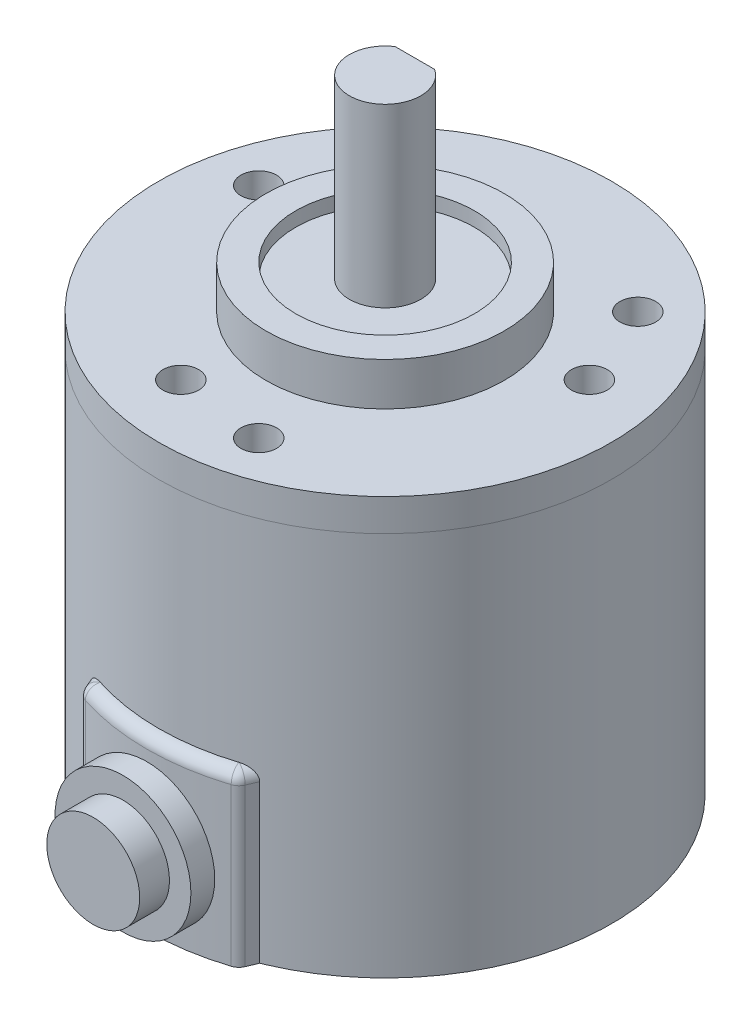
from build123d import *

# Parameters (mm, degrees)
SKETCH2_R               = 18.999999999999996
BOSS_EXTRUDE1_DEPTH     = 32.3
SKETCH3_R               = 18.999999999999996
BOSS_EXTRUDE2_DEPTH     = 2.7
SKETCH4_R               = 1.5000000000000024
SKETCH4_R_2             = 1.5000000000000022
SKETCH4_R_3             = 1.4999999999999998
SKETCH4_R_4             = 1.499999999999997
SKETCH4_R_5             = 1.5000000000000009
CUT_EXTRUDE1_DEPTH      = 6
SKETCH4_3_R             = 10
BOSS_EXTRUDE3_DEPTH     = 3.6
SKETCH5_R               = 7.5
CUT_EXTRUDE2_DEPTH      = 1.2
SKETCH6_R               = 3
BOSS_EXTRUDE4_DEPTH     = 14.8
CUT_EXTRUDE3_DEPTH      = 59.70979475351621
CUT_EXTRUDE3_DEPTH_BACK = 10
BOSS_EXTRUDE5_DEPTH     = 14.2
FILLET1_R               = 1
SKETCH9_R               = 5.7
BOSS_EXTRUDE6_DEPTH     = 2
SKETCH10_R              = 3.9000000000000004
BOSS_EXTRUDE7_DEPTH     = 2.5


with BuildPart() as part:
    # Sketch2 → Boss-Extrude1 (new body)
    with BuildSketch(Plane(origin=(0, 0, 0), x_dir=(1, 0, 0), z_dir=(0, 1, 0))):
        with Locations(Location((0, 0, 0), (0, 0, 270))):
            Circle(SKETCH2_R)
    extrude(amount=BOSS_EXTRUDE1_DEPTH)


with BuildPart() as body_2:
    # Sketch3 → Boss-Extrude2 (new body)
    with BuildSketch(Plane(origin=(0, 32.3, 0), x_dir=(1, 0, 0), z_dir=(0, 1, 0))):
        with Locations(Location((0, 0, 0), (0, 0, 90))):
            Circle(SKETCH3_R)
    extrude(amount=BOSS_EXTRUDE2_DEPTH)


with BuildPart() as cut_extrude1_tool:
    # Sketch4 → Cut-Extrude1 (new body)
    with BuildSketch(Plane(origin=(0, 34.99999999999999, 0), x_dir=(1, 0, 0), z_dir=(0, 1, 0))):
        with Locations(Location((-9.899494936611665, 9.899494936611667, 0), (0, 0, 270))):
            Circle(SKETCH4_R)
        with Locations(Location((-14.48888739433603, 3.8822856765377947, 0), (0, 0, 270))):
            Circle(SKETCH4_R_2)
        with Locations(Location((-3.6234666314352975, -13.522961568046956, 0), (0, 0, 270))):
            Circle(SKETCH4_R_3)
        with Locations(Location((3.882285676537826, -14.488887394336023, 0), (0, 0, 270))):
            Circle(SKETCH4_R_3)
        with Locations(Location((13.522961568046957, 3.623466631435291, 0), (0, 0, 270))):
            Circle(SKETCH4_R_4)
        with Locations(Location((10.606601717798199, 10.60660171779823, 0), (0, 0, 270))):
            Circle(SKETCH4_R_5)
    extrude(amount=-CUT_EXTRUDE1_DEPTH)


with BuildPart() as part_1:
    add(part.part)

    # Cut-Extrude1: cut by cut_extrude1_tool
    add(cut_extrude1_tool.part, mode=Mode.SUBTRACT)


with BuildPart() as body_2_1:
    add(body_2.part)

    # Cut-Extrude1: cut by cut_extrude1_tool
    add(cut_extrude1_tool.part, mode=Mode.SUBTRACT)

    # Sketch4<3> → Boss-Extrude3 (add)
    with BuildSketch(Plane(origin=(0, 34.99999999999999, 0), x_dir=(1, 0, 0), z_dir=(0, 1, 0))):
        with Locations(Location((0, 0, 0), (0, 0, 270))):
            Circle(SKETCH4_3_R)
    extrude(amount=BOSS_EXTRUDE3_DEPTH)

    # Sketch5 → Cut-Extrude2 (cut)
    with BuildSketch(Plane(origin=(0, 38.599999999999994, 0), x_dir=(1, 0, 0), z_dir=(0, 1, 0))):
        with Locations(Location((0, 0, 0), (0, 0, 270))):
            Circle(SKETCH5_R)
    extrude(amount=-CUT_EXTRUDE2_DEPTH, mode=Mode.SUBTRACT)

    # Sketch6 → Boss-Extrude4 (add)
    with BuildSketch(Plane(origin=(0, 37.4, 0), x_dir=(1, 0, 0), z_dir=(0, 1, 0))):
        with Locations(Location((0, 0, 0), (0, 0, 270))):
            Circle(SKETCH6_R)
    extrude(amount=BOSS_EXTRUDE4_DEPTH)

    # Sketch7 → Cut-Extrude3 (cut, two sides: drawn at the far end of the back side and taken through both)
    with BuildSketch(Plane(origin=(0, 52.199999999999996, 0), x_dir=(1, 0, 0), z_dir=(0, 1, 0)).offset(-CUT_EXTRUDE3_DEPTH_BACK)):
        Polygon((-71.29105075312172, 2.5), (-1.6583123951777008, 2.5), (1.6583123951777008, 2.5), (71.29105075312172, 2.5), (71.29105075312172, 141.76547671588804), (-71.29105075312172, 141.76547671588804), align=None)
    extrude(amount=CUT_EXTRUDE3_DEPTH + CUT_EXTRUDE3_DEPTH_BACK, mode=Mode.SUBTRACT)


with BuildPart() as body_3:
    # Sketch8 → Boss-Extrude5 (new body)
    with BuildSketch(Plane.XZ):
        with BuildLine():
            ThreePointArc((-7.1000000000000005, 17.623563771269417), (-3.616095155404414, 18.652717116470207), (3.5133e-13, 18.999999999999996))
            Line((0, 18.999999999999996), (0, 20))
            ThreePointArc((1.22e-15, 20), (-0.6540571990327249, 19.989302368526857), (-1.3074147117776902, 19.957220918039347))
            Line((-1.3074147117776898, 19.95722091803935), (-7.099999999999999, 17.623563771269414))
        make_face()
        with BuildLine():
            Line((-6.559330631564653, 18.893786853508686), (-7.099999999999999, 17.623563771269414))
            Line((-7.099999999999999, 17.623563771269414), (-1.3074147117776898, 19.95722091803935))
            ThreePointArc((-1.3074147117776902, 19.957220918039347), (-3.969148973854553, 19.602190092521532), (-6.559330631564651, 18.893786853508686))
        make_face()
        with BuildLine():
            Line((0, 20), (0, 18.999999999999996))
            ThreePointArc((3.5133e-13, 18.999999999999996), (3.6160951554047602, 18.65271711647014), (7.1, 17.623563771269417))
            Line((7.099999999999999, 17.623563771269414), (6.559330631564646, 18.893786853508686))
            ThreePointArc((6.559330631564646, 18.89378685350869), (3.325978271864252, 19.721507765256867), (1.22e-15, 20))
        make_face()
    extrude(amount=-BOSS_EXTRUDE5_DEPTH)

    # Fillet1
    fillet1_edges = [body_3.edges().sort_by_distance(p)[0] for p in [
        (-6.829665315782326, 14.2, 18.25867531238905),
        (6.829665315782322, 14.2, 18.25867531238905),
        (-3.77e-15, 14.2, 20.000000000000007),
        (6.559330631564646, 7.1, 18.893786853508686),
        (-6.559330631564653, 7.1, 18.893786853508686),
    ]]
    fillet(fillet1_edges, radius=FILLET1_R - 0.0001)  # a hair under: the kernel refuses the full size


with BuildPart() as body_4:
    # Sketch9 → Boss-Extrude6 (new body)
    with BuildSketch(Plane.XY.offset(20)):
        with Locations((0, 6.6)):
            Circle(SKETCH9_R)
    extrude(amount=BOSS_EXTRUDE6_DEPTH)

    # Sketch10 → Boss-Extrude7 (add)
    with BuildSketch(Plane.XY.offset(22)):
        with Locations((0, 6.6)):
            Circle(SKETCH10_R)
    extrude(amount=BOSS_EXTRUDE7_DEPTH)


solid = Compound([part_1.part, body_2_1.part, body_3.part, body_4.part])
